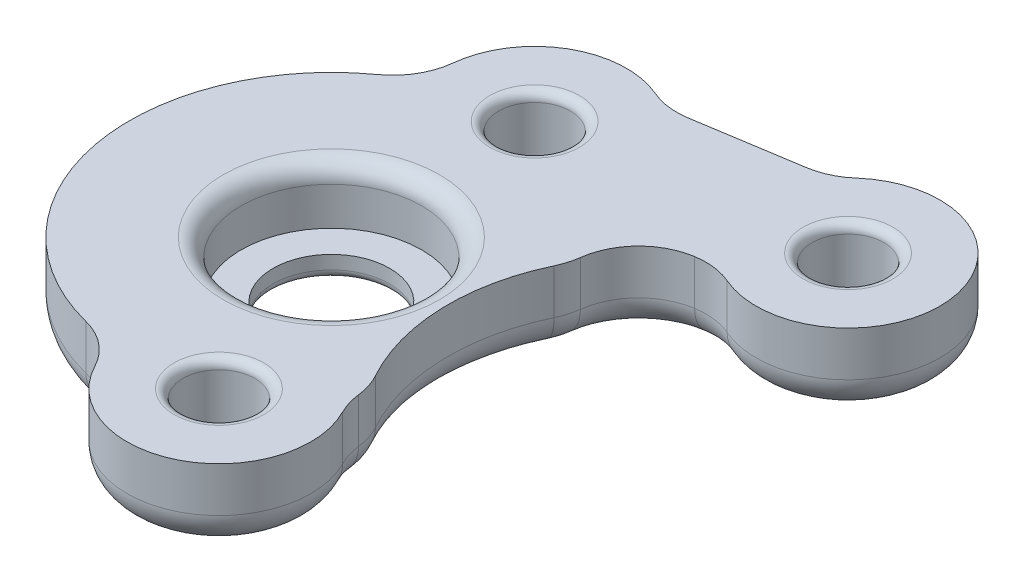
from build123d import *

# Parameters (mm, degrees)
SKETCH1_R           = 9
SKETCH1_R_2         = 4.025
BOSS_EXTRUDE1_DEPTH = 3.5
SKETCH2_R           = 4.1
SKETCH2_R_2         = 1.6
BOSS_EXTRUDE2_DEPTH = 3.5
SKETCH6_R           = 9
CUT_EXTRUDE2_DEPTH  = 17.27435259
CUT_EXTRUDE1_START  = -3.5
SKETCH3_R           = 1.6
CUT_EXTRUDE1_DEPTH  = 3.5
SKETCH4_R           = 1.6
BOSS_EXTRUDE3_DEPTH = 3.5
SKETCH5_R           = 4.025
SKETCH5_R_2         = 2.6
BOSS_EXTRUDE4_DEPTH = 1
FILLET1_R           = 3
FILLET9_R           = 3
FILLET5_R           = 1.5
FILLET6_R           = 0.4
FILLET7_R           = 0.8
FILLET8_R           = 0.4


with BuildPart() as part:
    # Sketch1 → Boss-Extrude1 (new body)
    with BuildSketch(Plane(origin=(0, 0, 0), x_dir=(1, 0, 0), z_dir=(0, 1, 0))):
        with Locations(Location((0, 0, 0), (0, 0, 270))):
            Circle(SKETCH1_R)
        with Locations(Location((0, 0, 0), (0, 0, 270))):
            Circle(SKETCH1_R_2, mode=Mode.SUBTRACT)
    extrude(amount=BOSS_EXTRUDE1_DEPTH)

    # Sketch2 → Boss-Extrude2 (add)
    # profile 1 of 2: a face of its own
    with BuildSketch(Plane(origin=(0, 3.5, 0), x_dir=(1, 0, 0), z_dir=(0, 1, 0))):
        with Locations((3.343277014, -8.355985807)):
            Circle(SKETCH2_R)
        with Locations((3.343277014, -8.355985807)):
            Circle(SKETCH2_R_2, mode=Mode.SUBTRACT)
    # profile 2 of 2: a face of its own
    with BuildSketch(Plane(origin=(0, 3.5, 0), x_dir=(1, 0, 0), z_dir=(0, 1, 0))):
        with Locations((0.061177946, 8.999792068)):
            Circle(SKETCH2_R)
        with Locations((0.061177946, 8.999792068)):
            Circle(SKETCH2_R_2, mode=Mode.SUBTRACT)
    extrude(amount=-BOSS_EXTRUDE2_DEPTH)

    # Sketch6 → Cut-Extrude2 (cut, through all)
    with BuildSketch(Plane(origin=(0, 0, 0), x_dir=(-1, 0, 0), z_dir=(0, -1, 0))):
        with Locations((-14.2, 0)):
            Circle(SKETCH6_R)
    extrude(amount=-CUT_EXTRUDE2_DEPTH, mode=Mode.SUBTRACT)

    # Sketch3 → Cut-Extrude1 (cut)
    with BuildSketch(Plane(origin=(0, 0, 0), x_dir=(-1, 0, 0), z_dir=(0, -1, 0)).offset(CUT_EXTRUDE1_START)):
        with Locations(Location((-0.061177946, 8.999792068, 0), (0, 0, 270))):
            Circle(SKETCH3_R)
        with Locations(Location((-3.343277014, -8.355985807, 0), (0, 0, 270))):
            Circle(SKETCH3_R)
    extrude(amount=CUT_EXTRUDE1_DEPTH, mode=Mode.SUBTRACT)

    # Sketch4 → Boss-Extrude3 (add)
    with BuildSketch(Plane(origin=(0, 0, 0), x_dir=(-1, 0, 0), z_dir=(0, -1, 0))):
        with BuildLine():
            Line((-2.353733001, 12.398937743), (-8.897987933, 13.432234974))
            ThreePointArc((-8.897987933, 13.432234974), (-16.176141716, 11.544244815), (-9.833757914, 7.505656319))
            Line((-9.833757914, 7.505656319), (-5.813078926, 6.870816065))
            ThreePointArc((-5.813078926, 6.870816065), (-4.964487715, 7.506920922), (-4.04696144, 8.038787415))
            ThreePointArc((-4.04696144, 8.038787415), (-3.883103044, 10.484005175), (-2.353733001, 12.398937743))
        make_face()
        with Locations(Location((-12.126312969, 10.904801994, 0), (0, 0, 90))):
            Circle(SKETCH4_R, mode=Mode.SUBTRACT)
    extrude(amount=-BOSS_EXTRUDE3_DEPTH)

    # Sketch5 → Boss-Extrude4 (add)
    with BuildSketch(Plane(origin=(0, 0, 0), x_dir=(-1, 0, 0), z_dir=(0, -1, 0))):
        with Locations(Location((0, 0, 0), (0, 0, 90))):
            Circle(SKETCH5_R)
        with Locations(Location((0, 0, 0), (0, 0, 90))):
            Circle(SKETCH5_R_2, mode=Mode.SUBTRACT)
    extrude(amount=-BOSS_EXTRUDE4_DEPTH)

    # Fillet1
    # the kernel refuses this fillet: 3 mm, written as the material it adds along each edge
    with BuildSketch(Plane(origin=(-0.71019136, 3.5, 8.97193559), x_dir=(-0.9865858542334134, 0, -0.1632432302624714), z_dir=(0, -1, 0))) as fillet1_piece_1:
        with BuildLine():
            CenterArc((1.782533661, -2.98917289), FILLET1_R, 94.869271374, 48.27534012)
            ThreePointArc((-0.617922081, -1.189780705), (-0.260000299, -0.620318503), (0, 0))
            ThreePointArc((0, 0), (0.763942997, -0.03248133), (1.527885995, 0))
        make_face()
    extrude(amount=3.5)
    with BuildSketch(Plane(origin=(-3.93730186, 3.5, -8.093062095), x_dir=(-0.8588495215516518, 0, 0.5122279759350309), z_dir=(0, -1, 0))) as fillet1_piece_2:
        with BuildLine():
            CenterArc((1.782533661, 2.98917289), FILLET1_R, 216.855388506, 48.27534012)
            ThreePointArc((-0.617922081, 1.189780705), (-0.260000299, 0.620318503), (0, 0))
            ThreePointArc((0, 0), (0.763942997, 0.03248133), (1.527885995, 0))
        make_face()
    extrude(amount=3.5)
    with BuildSketch(Plane(origin=(8.897987933, 0, -13.432234974), x_dir=(-0.9877631090139599, 0, 0.15596166346598195), z_dir=(0, 1, 0))) as fillet1_piece_3:
        with BuildLine():
            CenterArc((1.001412857, -3), FILLET1_R, 90, 32.320518146)
            ThreePointArc((-0.602552177, -0.464788732), (-0.290469322, -0.24640426), (0, 0))
            Line((0, 0), (1.001412857, 0))
        make_face()
    extrude(amount=3.5)
    with BuildSketch(Plane(origin=(2.353733001, 0, -12.398937743), x_dir=(-0.8773738132879287, 0, -0.4798074527939294), z_dir=(0, 1, 0)), Plane(origin=(9.833757914, 0, -7.505656319), x_dir=(0.8773738132879222, 0, 0.47980745279394127), z_dir=(0, 1, 0))) as fillet1_piece_4:
        with BuildLine():
            CenterArc((1.039393717, -2.987053466), FILLET1_R, 95.324882893, 32.320518146)
            Line((-0.792924625, -0.611635715), (0, 0))
            ThreePointArc((0, 0), (0.380492343, -0.017693596), (0.760984685, 0))
        make_face()
    extrude(amount=3.5)
    # the kernel refuses this fillet: 3 mm, written as the material it takes off along each edge
    with BuildSketch(Plane(origin=(7.1, 6.983871428, 5.530822724), x_dir=(-0.6413091964506672, 0, 0.7672825519636162), z_dir=(0, -1, 0))) as fillet1_2_piece_1:
        with BuildLine():
            CenterArc((2.400494629, 2.413903277), FILLET1_R, 201.072777054, 32.502187501)
            ThreePointArc((-0.398878795, 1.335242797), (-0.173557144, 0.675353237), (0, 0))
            ThreePointArc((0, 0), (0.309591521, -0.005326404), (0.619183042, 0))
        make_face()
    extrude(amount=10.467742856, mode=Mode.SUBTRACT)
    with BuildSketch(Plane(origin=(7.1, 8.410224582, -5.530822724), x_dir=(-0.5247859915025788, 0, 0.8512341999254115), z_dir=(0, -1, 0))) as fillet1_2_piece_2:
        with BuildLine():
            CenterArc((2.291438138, 2.982087035), FILLET1_R, 203.232841743, 60.502793026)
            ThreePointArc((-0.465290008, 1.798680965), (-0.279182448, 0.88730199), (0, 0))
            ThreePointArc((0, 0), (0.982044916, 0.053738894), (1.964089833, 0))
        make_face()
    extrude(amount=13.320449164, mode=Mode.SUBTRACT)

    # Fillet9
    fillet9_edges = [part.edges().sort_by_distance(p)[0] for p in [
        (6.702912221, 1.75, 6.005911068),
        (5.813078926, 1.75, -6.870816065),
    ]]
    fillet(fillet9_edges, radius=FILLET9_R)

    # Fillet5
    fillet5_edges = [part.edges().sort_by_distance(p)[0] for p in [
        (16.176141716, 0, -11.544244815),
        (5.625860467, 0, -12.915586358),
        (-2.007663811, 0, -12.539551069),
        (5.204560758, 0, 0.286483569),
        (5.220072831, 0, 12.001206989),
        (-8.84326494, 0, 1.672323294),
        (6.564091926, 0, 4.905386326),
        (9.687844205, 0, -7.362609827),
        (8.715099113, 0, -13.523365587),
        (2.49964671, 0, -12.541984235),
        (-4.406035705, 0, -8.239061366),
        (-1.093245074, 0, 9.27901385),
        (8.843752485, 0, -7.349340608),
        (6.238006504, 0, -4.301725459),
        (7.158194759, 0, -6.475494242),
        (6.796639749, 0, 5.998875214),
    ]]
    fillet(fillet5_edges, radius=FILLET5_R)

    # Fillet6
    fillet6_edges = [part.edges().sort_by_distance(p)[0] for p in [
        (4.706817353, 0, 9.19309855),
        (1.13707684, 0, -7.815544808),
        (12.126312969, 0, -9.304801994),
        (0, 0, 2.6),
    ]]
    fillet(fillet6_edges, radius=FILLET6_R)

    # Fillet7
    fillet7_edges = [part.edges().sort_by_distance(p)[0] for p in [
        (0, 3.5, -4.025),
    ]]
    fillet(fillet7_edges, radius=FILLET7_R)

    # Fillet8
    fillet8_edges = [part.edges().sort_by_distance(p)[0] for p in [
        (4.706817353, 3.5, 9.19309855),
        (1.13707684, 3.5, -7.815544808),
        (12.126312969, 3.5, -9.304801994),
    ]]
    fillet(fillet8_edges, radius=FILLET8_R)


solid = part.part
